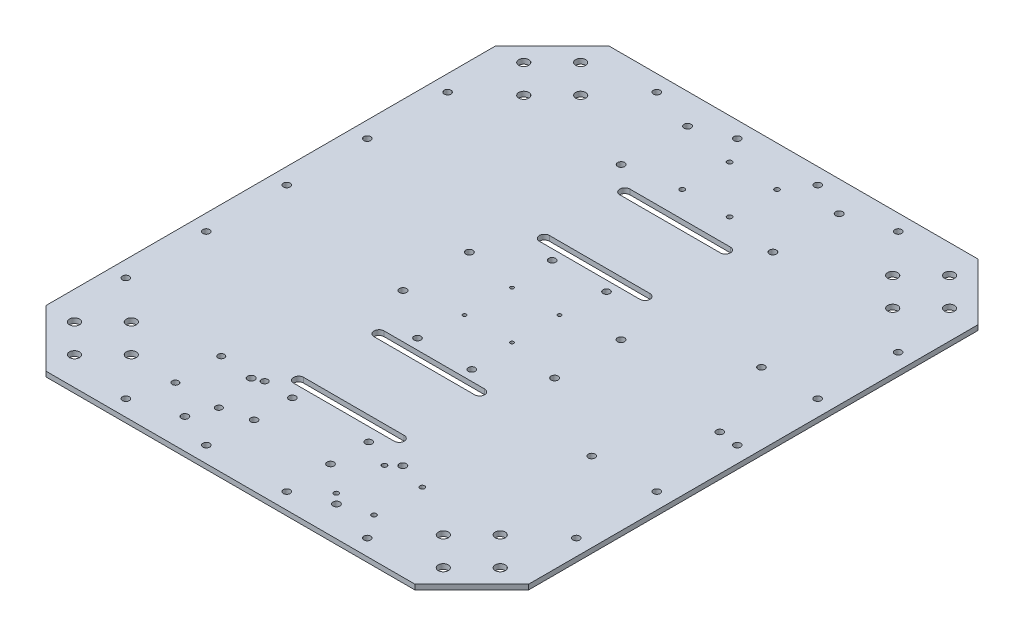
from build123d import *

# Parameters (mm, degrees)
SKETCH1_R               = 2.2225
BOSS_EXTRUDE1_DEPTH     = 3.175
SKETCH2_R               = 2.159
CUT_EXTRUDE1_DEPTH      = 297.247830215
CUT_EXTRUDE2_DEPTH      = 297.247830215
SKETCH7_R               = 1.524
CUT_EXTRUDE3_DEPTH      = 297.247830215
CUT_EXTRUDE4_DEPTH      = 297.247830215
CUT_EXTRUDE4_DEPTH_BACK = 297.247830215
SKETCH8_R               = 1.524
SKETCH10_R              = 2.159
CUT_EXTRUDE6_DEPTH      = 297.247830215
SKETCH9_R               = 2.032
CUT_EXTRUDE5_DEPTH      = 297.247830215
SKETCH13_R              = 1.1
CUT_EXTRUDE8_DEPTH      = 297.247830215
SKETCH14_R              = 3.175
CUT_EXTRUDE9_DEPTH      = 297.247830215
SKETCH15_R              = 2.159
CUT_EXTRUDE10_DEPTH     = 297.247830215
SKETCH16_R              = 2.159
CUT_EXTRUDE11_DEPTH     = 297.247830215


with BuildPart() as part:
    # Sketch1 → Boss-Extrude1 (new body)
    with BuildSketch(Plane(origin=(0, 0, 0), x_dir=(1, 0, 0), z_dir=(0, 1, 0))):
        Polygon((-85.365028143, 123.058976948), (-121.286052627, 87.137952464), (-121.286052627, -196.619998567), (-85.365028143, -232.541023052), (147.592922888, -232.541023052), (183.513947373, -196.619998567), (183.513947373, 87.137952464), (147.592922888, 123.058976948), align=None)
        with Locations((-16.765052627, -213.491023052)):
            Circle(SKETCH1_R, mode=Mode.SUBTRACT)
        with Locations((-16.765052627, -171.581023052)):
            Circle(SKETCH1_R, mode=Mode.SUBTRACT)
        with Locations((-16.765052627, -75.696023052)):
            Circle(SKETCH1_R, mode=Mode.SUBTRACT)
        with Locations((78.992947373, -213.491023052)):
            Circle(SKETCH1_R, mode=Mode.SUBTRACT)
        with Locations((78.992947373, -171.581023052)):
            Circle(SKETCH1_R, mode=Mode.SUBTRACT)
        with Locations((78.992947373, -75.696023052)):
            Circle(SKETCH1_R, mode=Mode.SUBTRACT)
        with Locations((-16.765052627, -33.786023052)):
            Circle(SKETCH1_R, mode=Mode.SUBTRACT)
        with Locations((-16.765052627, 62.098976948)):
            Circle(SKETCH1_R, mode=Mode.SUBTRACT)
        with Locations((-16.765052627, 104.008976948)):
            Circle(SKETCH1_R, mode=Mode.SUBTRACT)
        with Locations((78.992947373, -33.786023052)):
            Circle(SKETCH1_R, mode=Mode.SUBTRACT)
        with Locations((78.992947373, 62.098976948)):
            Circle(SKETCH1_R, mode=Mode.SUBTRACT)
        with Locations((78.992947373, 104.008976948)):
            Circle(SKETCH1_R, mode=Mode.SUBTRACT)
    extrude(amount=BOSS_EXTRUDE1_DEPTH)

    # Sketch2 → Cut-Extrude1 (cut, through all)
    with BuildSketch(Plane(origin=(0, 3.175, 0), x_dir=(1, 0, 0), z_dir=(0, 1, 0))):
        with Locations((13.841947373, -12.069023052)):
            Circle(SKETCH2_R)
        with Locations((48.131947373, -12.069023052)):
            Circle(SKETCH2_R)
        with Locations((13.841947373, -97.159023052)):
            Circle(SKETCH2_R)
        with Locations((48.131947373, -97.159023052)):
            Circle(SKETCH2_R)
    extrude(amount=-CUT_EXTRUDE1_DEPTH, mode=Mode.SUBTRACT)

    # Sketch4 → Cut-Extrude2 (cut, through all)
    with BuildSketch(Plane(origin=(0, 3.175, 0), x_dir=(1, 0, 0), z_dir=(0, 1, 0))):
        with BuildLine():
            Line((-0.636052627, 51.430976948), (62.863947373, 51.430976948))
            ThreePointArc((62.863947373, 51.430976948), (66.038947373, 48.255976948), (62.863947373, 45.080976948))
            Line((62.863947373, 45.080976948), (-0.636052627, 45.080976948))
            ThreePointArc((-0.636052627, 45.080976948), (-3.811052627, 48.255976948), (-0.636052627, 51.430976948))
        make_face()
        with BuildLine():
            Line((-0.636052627, 0.630976948), (62.863947373, 0.630976948))
            ThreePointArc((62.863947373, 0.630976948), (66.038947373, -2.544023052), (62.863947373, -5.719023052))
            Line((62.863947373, -5.719023052), (-0.636052627, -5.719023052))
            ThreePointArc((-0.636052627, -5.719023052), (-3.811052627, -2.544023052), (-0.636052627, 0.630976948))
        make_face()
        with BuildLine():
            Line((-0.636052627, -110.113023052), (62.863947373, -110.113023052))
            ThreePointArc((62.863947373, -110.113023052), (66.038947373, -106.938023052), (62.863947373, -103.763023052))
            Line((62.863947373, -103.763023052), (-0.636052627, -103.763023052))
            ThreePointArc((-0.636052627, -103.763023052), (-3.811052627, -106.938023052), (-0.636052627, -110.113023052))
        make_face()
        with BuildLine():
            Line((-0.636052627, -160.913023052), (62.863947373, -160.913023052))
            ThreePointArc((62.863947373, -160.913023052), (66.038947373, -157.738023052), (62.863947373, -154.563023052))
            Line((62.863947373, -154.563023052), (-0.636052627, -154.563023052))
            ThreePointArc((-0.636052627, -154.563023052), (-3.811052627, -157.738023052), (-0.636052627, -160.913023052))
        make_face()
    extrude(amount=-CUT_EXTRUDE2_DEPTH, mode=Mode.SUBTRACT)

    # Sketch7 → Cut-Extrude3 (cut, through all)
    with BuildSketch(Plane(origin=(0, 3.175, 0), x_dir=(1, 0, 0), z_dir=(0, 1, 0))):
        with Locations((16.127947373, 67.686976948)):
            Circle(SKETCH7_R)
        with Locations((46.099947373, 67.686976948)):
            Circle(SKETCH7_R)
        with Locations((16.127947373, 97.658976948)):
            Circle(SKETCH7_R)
        with Locations((46.099947373, 97.658976948)):
            Circle(SKETCH7_R)
    extrude(amount=-CUT_EXTRUDE3_DEPTH, mode=Mode.SUBTRACT)

    # Sketch8 → Cut-Extrude4 (cut, two sides: drawn at the far end of the back side and taken through both)
    with BuildSketch(Plane(origin=(0, 3.175, 0), x_dir=(1, 0, 0), z_dir=(0, 1, 0)).offset(-CUT_EXTRUDE4_DEPTH_BACK)):
        with Locations((73.023947373, -207.649023052)):
            Circle(SKETCH8_R)
        with Locations((73.023947373, -177.169023052)):
            Circle(SKETCH8_R)
        with Locations((96.899947373, -207.649023052)):
            Circle(SKETCH8_R)
        with Locations((96.899947373, -177.169023052)):
            Circle(SKETCH8_R)
    extrude(amount=CUT_EXTRUDE4_DEPTH + CUT_EXTRUDE4_DEPTH_BACK, mode=Mode.SUBTRACT)

    # Sketch10 → Cut-Extrude6 (cut, through all)
    with BuildSketch(Plane.XZ):
        with Locations((6.983947373, 193.475823052)):
            Circle(SKETCH10_R)
        with Locations((55.243947373, 193.475823052)):
            Circle(SKETCH10_R)
        with Locations((6.983947373, 169.345823052)):
            Circle(SKETCH10_R)
        with Locations((55.243947373, 169.345823052)):
            Circle(SKETCH10_R)
    extrude(amount=-CUT_EXTRUDE6_DEPTH, mode=Mode.SUBTRACT)

    # Sketch9 → Cut-Extrude5 (cut, through all)
    with BuildSketch(Plane(origin=(0, 0, 0), x_dir=(-1, 0, 0), z_dir=(0, -1, 0))):
        with Locations((38.228052627, -197.969083052)):
            Circle(SKETCH9_R)
        with Locations((10.796052627, -197.969083052)):
            Circle(SKETCH9_R)
        with Locations((38.228052627, -169.013083052)):
            Circle(SKETCH9_R)
        with Locations((10.796052627, -169.013083052)):
            Circle(SKETCH9_R)
    extrude(amount=-CUT_EXTRUDE5_DEPTH, mode=Mode.SUBTRACT)

    # Sketch13 → Cut-Extrude8 (cut, through all)
    with BuildSketch(Plane.XZ):
        with Locations((16.113947373, 69.741023052)):
            Circle(SKETCH13_R)
        with Locations((16.113947373, 39.741023052)):
            Circle(SKETCH13_R)
        with Locations((46.113947373, 39.741023052)):
            Circle(SKETCH13_R)
        with Locations((46.113947373, 69.741023052)):
            Circle(SKETCH13_R)
    extrude(amount=-CUT_EXTRUDE8_DEPTH, mode=Mode.SUBTRACT)

    # Sketch14 → Cut-Extrude9 (cut, through all)
    with BuildSketch(Plane.XZ):
        with Locations((-103.325540385, 196.619998567)):
            Circle(SKETCH14_R)
        with Locations((-85.365028143, 214.580510809)):
            Circle(SKETCH14_R)
        with Locations((-85.365028143, 178.659486325)):
            Circle(SKETCH14_R)
        with Locations((-67.404515901, 196.619998567)):
            Circle(SKETCH14_R)
        with Locations((129.632410646, 196.619998567)):
            Circle(SKETCH14_R)
        with Locations((147.592922888, 178.659486325)):
            Circle(SKETCH14_R)
        with Locations((165.55343513, 196.619998567)):
            Circle(SKETCH14_R)
        with Locations((147.592922888, 214.580510809)):
            Circle(SKETCH14_R)
        with Locations((-85.365028143, -105.098464706)):
            Circle(SKETCH14_R)
        with Locations((-103.325540385, -87.137952464)):
            Circle(SKETCH14_R)
        with Locations((-85.365028143, -69.177440222)):
            Circle(SKETCH14_R)
        with Locations((-67.404515901, -87.137952464)):
            Circle(SKETCH14_R)
        with Locations((165.55343513, -87.137952464)):
            Circle(SKETCH14_R)
        with Locations((147.592922888, -69.177440222)):
            Circle(SKETCH14_R)
        with Locations((147.592922888, -105.098464706)):
            Circle(SKETCH14_R)
        with Locations((129.632410646, -87.137952464)):
            Circle(SKETCH14_R)
    extrude(amount=-CUT_EXTRUDE9_DEPTH, mode=Mode.SUBTRACT)

    # Sketch15 → Cut-Extrude10 (cut, through all)
    with BuildSketch(Plane.XZ):
        with Locations((5.713947373, 222.381023052)):
            Circle(SKETCH15_R)
        with Locations((-45.086052627, 222.381023052)):
            Circle(SKETCH15_R)
        with Locations((-111.126052627, 54.741023052)):
            Circle(SKETCH15_R)
        with Locations((-111.126052627, 105.541023052)):
            Circle(SKETCH15_R)
        with Locations((-111.126052627, 156.341023052)):
            Circle(SKETCH15_R)
        with Locations((173.353947373, 156.341023052)):
            Circle(SKETCH15_R)
        with Locations((173.353947373, 105.541023052)):
            Circle(SKETCH15_R)
        with Locations((173.353947373, 54.741023052)):
            Circle(SKETCH15_R)
        with Locations((107.313947373, 222.381023052)):
            Circle(SKETCH15_R)
        with Locations((56.513947373, 222.381023052)):
            Circle(SKETCH15_R)
        with Locations((56.513947373, -112.898976948)):
            Circle(SKETCH15_R)
        with Locations((107.313947373, -112.898976948)):
            Circle(SKETCH15_R)
        with Locations((173.353947373, 3.941023052)):
            Circle(SKETCH15_R)
        with Locations((173.353947373, -46.858976948)):
            Circle(SKETCH15_R)
        with Locations((-111.126052627, -46.858976948)):
            Circle(SKETCH15_R)
        with Locations((-111.126052627, 3.941023052)):
            Circle(SKETCH15_R)
        with Locations((-45.086052627, -112.898976948)):
            Circle(SKETCH15_R)
        with Locations((5.713947373, -112.898976948)):
            Circle(SKETCH15_R)
    extrude(amount=-CUT_EXTRUDE10_DEPTH, mode=Mode.SUBTRACT)

    # Sketch16 → Cut-Extrude11 (cut, through all)
    with BuildSketch(Plane(origin=(0, 0, 0), x_dir=(-1, 0, 0), z_dir=(0, -1, 0))):
        with Locations((-133.333707373, -106.679409794)):
            Circle(SKETCH16_R)
        with Locations((-138.413707373, -4.529409794)):
            Circle(SKETCH16_R)
        with Locations((-160.653947373, -53.029409794)):
            Circle(SKETCH16_R)
    extrude(amount=-CUT_EXTRUDE11_DEPTH, mode=Mode.SUBTRACT)


solid = part.part
